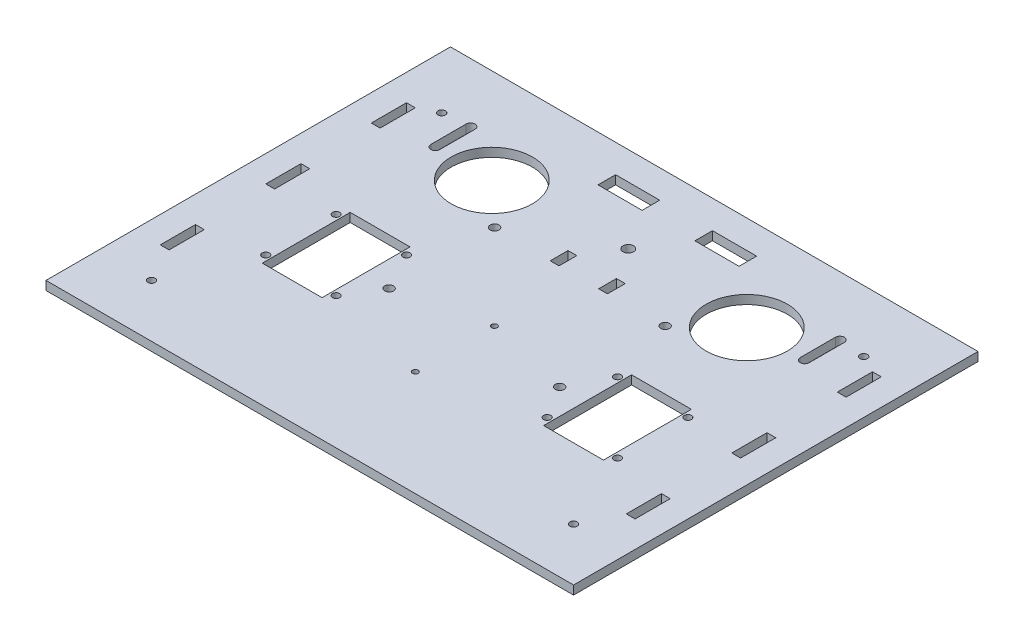
from build123d import *

# Parameters (mm, degrees)
SKETCH_1_R          = 2.1
SKETCH_1_W          = 5
SKETCH_1_H          = 20
EXTRUDE_1_DEPTH     = 5
SKETCH_3_R          = 1.6
SKETCH_3_R_2        = 2.5
SKETCH_3_R_3        = 23.1
SKETCH_3_R_4        = 3
SKETCH_3_R_5        = 2.05
SKETCH_3_W          = 34
SKETCH_3_H          = 50
SKETCH_3_W_2        = 5
SKETCH_3_H_2        = 10.1
CUT_EXTRUDE_1_DEPTH = 193.158788506
SKETCH_5_W          = 25.1
SKETCH_5_H          = 10
CUT_EXTRUDE_5_DEPTH = 193.158788506


with BuildPart() as part:
    # 草圖1 → 填料-伸長1 (new body)
    with BuildSketch(Plane(origin=(0, 0, 0), x_dir=(1, 0, 0), z_dir=(0, 1, 0))):
        Polygon((-150, 100), (-150, -100), (-150, -120), (150, -120), (150, -100), (150, 100), (150, 110), (-150, 110), align=None)
        with Locations((-120, 75)):
            Circle(SKETCH_1_R, mode=Mode.SUBTRACT)
        with Locations((120, 75)):
            Circle(SKETCH_1_R, mode=Mode.SUBTRACT)
        with Locations((120, -90)):
            Circle(SKETCH_1_R, mode=Mode.SUBTRACT)
        with Locations((-120, -90)):
            Circle(SKETCH_1_R, mode=Mode.SUBTRACT)
        with Locations((132.5, -60)):
            Rectangle(SKETCH_1_W, SKETCH_1_H, mode=Mode.SUBTRACT)
        with Locations((-132.5, 60)):
            Rectangle(SKETCH_1_W, SKETCH_1_H, mode=Mode.SUBTRACT)
        with Locations((-132.5, 0)):
            Rectangle(SKETCH_1_W, SKETCH_1_H, mode=Mode.SUBTRACT)
        with Locations((-132.5, -60)):
            Rectangle(SKETCH_1_W, SKETCH_1_H, mode=Mode.SUBTRACT)
        with Locations((132.5, 0)):
            Rectangle(SKETCH_1_W, SKETCH_1_H, mode=Mode.SUBTRACT)
        with Locations((132.5, 60)):
            Rectangle(SKETCH_1_W, SKETCH_1_H, mode=Mode.SUBTRACT)
    extrude(amount=EXTRUDE_1_DEPTH)

    # 草圖3 → 除料-伸長1 (cut, through all)
    with BuildSketch(Plane(origin=(0, 5, 0), x_dir=(1, 0, 0), z_dir=(0, 1, 0))):
        with Locations((0, -60)):
            Circle(SKETCH_3_R)
        with Locations((0, -15)):
            Circle(SKETCH_3_R)
        with Locations((-48.5, 33.613872125)):
            Circle(SKETCH_3_R_2)
        with Locations((48.5, 33.613872125)):
            Circle(SKETCH_3_R_2)
        with Locations((48.5, -26.386127875)):
            Circle(SKETCH_3_R_2)
        with Locations((-48.5, -26.386127875)):
            Circle(SKETCH_3_R_2)
        with Locations((-72.5, 56)):
            Circle(SKETCH_3_R_3)
        with Locations((72.5, 56)):
            Circle(SKETCH_3_R_3)
        with Locations((0, 61.113872125)):
            Circle(SKETCH_3_R_4)
        with Locations((-100, -45)):
            Circle(SKETCH_3_R_5)
        with Locations((-60, -45)):
            Circle(SKETCH_3_R_5)
        with Locations((-60, -5)):
            Circle(SKETCH_3_R_5)
        with Locations((-100, -5)):
            Circle(SKETCH_3_R_5)
        with Locations((100, -5)):
            Circle(SKETCH_3_R_5)
        with Locations((60, -5)):
            Circle(SKETCH_3_R_5)
        with Locations((60, -45)):
            Circle(SKETCH_3_R_5)
        with Locations((100, -45)):
            Circle(SKETCH_3_R_5)
        with Locations((-80, -25)):
            Rectangle(SKETCH_3_W, SKETCH_3_H)
        with Locations((80, -25)):
            Rectangle(SKETCH_3_W, SKETCH_3_H)
        with Locations((-13.775, 38.063872125)):
            Rectangle(SKETCH_3_W_2, SKETCH_3_H_2)
        with Locations((13.775, 38.063872125)):
            Rectangle(SKETCH_3_W_2, SKETCH_3_H_2)
    extrude(amount=-CUT_EXTRUDE_1_DEPTH, mode=Mode.SUBTRACT)

    # 草圖5 → 除料-伸長5 (cut, through all)
    with BuildSketch(Plane(origin=(0, 5, 0), x_dir=(1, 0, 0), z_dir=(0, 1, 0))):
        with Locations((27.55, 89)):
            Rectangle(SKETCH_5_W, SKETCH_5_H)
        with Locations((-27.55, 89)):
            Rectangle(SKETCH_5_W, SKETCH_5_H)
        with BuildLine():
            Line((-102.45, 76.45), (-102.45, 56.45))
            ThreePointArc((-102.45, 56.45), (-105, 53.9), (-107.55, 56.45))
            Line((-107.55, 56.45), (-107.55, 76.45))
            ThreePointArc((-107.55, 76.45), (-105, 79), (-102.45, 76.45))
        make_face()
        with BuildLine():
            Line((102.45, 76.45), (102.45, 56.45))
            ThreePointArc((102.45, 56.45), (105, 53.9), (107.55, 56.45))
            Line((107.55, 56.45), (107.55, 76.45))
            ThreePointArc((107.55, 76.45), (105, 79), (102.45, 76.45))
        make_face()
    extrude(amount=-CUT_EXTRUDE_5_DEPTH, mode=Mode.SUBTRACT)


solid = part.part
